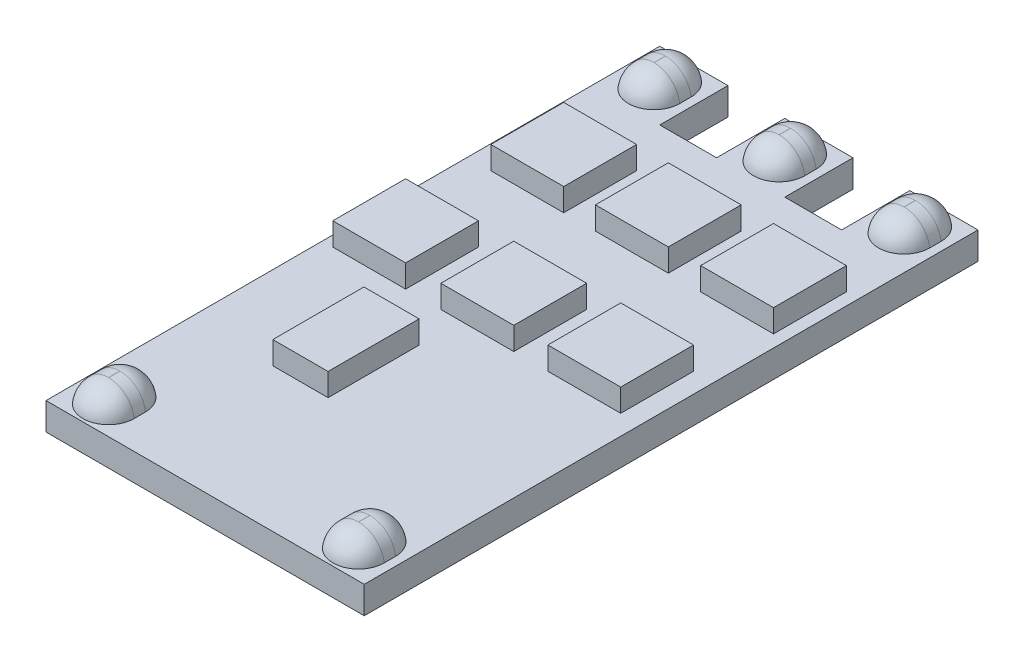
from build123d import *

# Parameters (mm, degrees)
SKETCH1_W               = 14
SKETCH1_H               = 24
SKETCH1_W_2             = 3
SKETCH1_H_2             = 3
PCB_DEPTH               = 1.2
SOLDER_JOINTS_DEPTH     = 1
SOLDER_FILLETS_R        = 1.125
SKETCH2_W               = 3.205722041
SKETCH2_H               = 3.205722042
SKETCH2_W_2             = 3.205722042
SKETCH2_W_3             = 2.430144128
SKETCH2_H_2             = 4.007152552
TOP_COMPONENTS_DEPTH    = 1
SKETCH3_W               = 4.033005149
SKETCH3_H               = 4.058308378
SKETCH3_W_2             = 3.102311653
SKETCH3_H_2             = 2.921343474
SKETCH3_W_3             = 2.817933085
SKETCH3_W_4             = 2.869638279
SKETCH3_W_5             = 1.835534395
SKETCH3_H_3             = 3.12816425
BOTTOM_COMPONENTS_DEPTH = 1


with BuildPart() as part:
    # Sketch1 → PCB (new body)
    with BuildSketch(Plane(origin=(0, 0, 0), x_dir=(1, 0, 0), z_dir=(0, 1, 0))):
        Rectangle(SKETCH1_W, SKETCH1_H)
        with Locations((-5.5, 13.5)):
            Rectangle(SKETCH1_W_2, SKETCH1_H_2)
        with Locations((0, 13.5)):
            Rectangle(SKETCH1_W_2, SKETCH1_H_2)
        with Locations((5.5, 13.5)):
            Rectangle(SKETCH1_W_2, SKETCH1_H_2)
    extrude(amount=PCB_DEPTH)

    # Sketch5 → Solder joints (add)
    with BuildSketch(Plane(origin=(0, 1.2, 0), x_dir=(1, 0, 0), z_dir=(0, 1, 0))):
        with BuildLine():
            Line((-4.375, 13.25), (-4.375, 13.75))
            ThreePointArc((-4.375, 13.75), (-5.5, 14.875), (-6.625, 13.75))
            Line((-6.625, 13.75), (-6.625, 13.25))
            ThreePointArc((-6.625, 13.25), (-5.5, 12.125), (-4.375, 13.25))
        make_face()
        with BuildLine():
            Line((-1.125, 13.75), (-1.125, 13.25))
            ThreePointArc((-1.125, 13.25), (0, 12.125), (1.125, 13.25))
            Line((1.125, 13.25), (1.125, 13.75))
            ThreePointArc((1.125, 13.75), (0, 14.875), (-1.125, 13.75))
        make_face()
        with BuildLine():
            Line((4.375, 13.75), (4.375, 13.25))
            ThreePointArc((4.375, 13.25), (5.5, 12.125), (6.625, 13.25))
            Line((6.625, 13.25), (6.625, 13.75))
            ThreePointArc((6.625, 13.75), (5.5, 14.875), (4.375, 13.75))
        make_face()
        with BuildLine():
            Line((-6.625, -10.25), (-6.625, -10.75))
            ThreePointArc((-6.625, -10.75), (-5.5, -11.875), (-4.375, -10.75))
            Line((-4.375, -10.75), (-4.375, -10.25))
            ThreePointArc((-4.375, -10.25), (-5.5, -9.125), (-6.625, -10.25))
        make_face()
        with BuildLine():
            ThreePointArc((6.625, -10.75), (5.5, -11.875), (4.375, -10.75))
            Line((4.375, -10.75), (4.375, -10.25))
            ThreePointArc((4.375, -10.25), (5.5, -9.125), (6.625, -10.25))
            Line((6.625, -10.25), (6.625, -10.75))
        make_face()
    extrude(amount=SOLDER_JOINTS_DEPTH)

    # Solder fillets
    # the kernel refuses this fillet: 1.125 mm, written as the material it takes off along each edge
    with BuildSketch(Plane(origin=(-5.5, 2.2, 10.25), x_dir=(1, 0, 0), z_dir=(0, 0, 1))) as solder_fillets_piece_1:
        with BuildLine():
            CenterArc((0.006966011, -1.125), SOLDER_FILLETS_R, 6.379370208, 83.620629792)
            Line((0.006966011, 0), (0.006966011, 0.0225))
            Line((0.006966011, 0.0225), (1.125, 0.0225))
            Line((1.125, 0.0225), (1.1475, 0))
            ThreePointArc((1.1475, 0), (1.1475, -0.5), (1.14736068, -0.9975))
            Line((1.14736068, -0.9975), (1.125, -1))
        make_face()
    revolve(axis=Axis((-5.5, 2.2, 10.25), (0, 1, 0)), revolution_arc=180, mode=Mode.SUBTRACT)
    with BuildSketch(Plane(origin=(-4.375, 2.2, 10.75), x_dir=(0, -1, 0), z_dir=(0, 0, -1)), Plane(origin=(-6.625, 2.2, 10.25), x_dir=(0, -1, 0), z_dir=(0, 0, 1)), Plane(origin=(6.625, 2.2, -13.25), x_dir=(0, -1, 0), z_dir=(0, 0, -1)), Plane(origin=(4.375, 2.2, -13.75), x_dir=(0, -1, 0), z_dir=(0, 0, 1)), Plane(origin=(1.125, 2.2, -13.25), x_dir=(0, -1, 0), z_dir=(0, 0, -1)), Plane(origin=(-1.125, 2.2, -13.75), x_dir=(0, -1, 0), z_dir=(0, 0, 1)), Plane(origin=(-6.625, 2.2, -13.75), x_dir=(0, -1, 0), z_dir=(0, 0, 1)), Plane(origin=(-4.375, 2.2, -13.25), x_dir=(0, -1, 0), z_dir=(0, 0, -1))) as solder_fillets_piece_2:
        with BuildLine():
            CenterArc((1.125, 1.118033989), SOLDER_FILLETS_R, 180, 83.620629792)
            Line((0, 1.118033989), (-0.0225, 1.118033989))
            Line((-0.0225, 1.118033989), (-0.0225, 0))
            Line((-0.0225, 0), (0, -0.0225))
            ThreePointArc((0, -0.0225), (0.5, -0.0225), (0.9975, -0.02236068))
            Line((0.9975, -0.02236068), (1, 0))
        make_face()
    extrude(amount=0.5, mode=Mode.SUBTRACT)
    with BuildSketch(Plane(origin=(-5.5, 2.2, 10.75), x_dir=(-1, 0, 0), z_dir=(0, 0, -1))) as solder_fillets_piece_3:
        with BuildLine():
            CenterArc((0.006966011, -1.125), SOLDER_FILLETS_R, 6.379370208, 83.620629792)
            Line((0.006966011, 0), (0.006966011, 0.0225))
            Line((0.006966011, 0.0225), (1.125, 0.0225))
            Line((1.125, 0.0225), (1.1475, 0))
            ThreePointArc((1.1475, 0), (1.1475, -0.5), (1.14736068, -0.9975))
            Line((1.14736068, -0.9975), (1.125, -1))
        make_face()
    revolve(axis=Axis((-5.5, 2.2, 10.75), (0, 1, 0)), revolution_arc=180, mode=Mode.SUBTRACT)
    with BuildSketch(Plane(origin=(4.375, 2.2, 10.75), x_dir=(0, -1, 0), z_dir=(0, 0, -1)), Plane(origin=(6.625, 2.2, 10.25), x_dir=(0, -1, 0), z_dir=(0, 0, 1))) as solder_fillets_piece_4:
        with BuildLine():
            CenterArc((1.125, -1.118033989), SOLDER_FILLETS_R, 96.379370208, 83.620629792)
            Line((0, -1.118033989), (-0.0225, -1.118033989))
            Line((-0.0225, -1.118033989), (-0.0225, 0))
            Line((-0.0225, 0), (0, 0.0225))
            ThreePointArc((0, 0.0225), (0.5, 0.0225), (0.9975, 0.02236068))
            Line((0.9975, 0.02236068), (1, 0))
        make_face()
    extrude(amount=0.5, mode=Mode.SUBTRACT)
    with BuildSketch(Plane(origin=(5.5, 2.2, 10.25), x_dir=(-1, 0, 0), z_dir=(0, 0, 1))) as solder_fillets_piece_5:
        with BuildLine():
            CenterArc((0.006966011, 1.125), SOLDER_FILLETS_R, 270, 83.620629792)
            Line((0.006966011, 0), (0.006966011, -0.0225))
            Line((0.006966011, -0.0225), (1.125, -0.0225))
            Line((1.125, -0.0225), (1.1475, 0))
            ThreePointArc((1.1475, 0), (1.1475, 0.5), (1.14736068, 0.9975))
            Line((1.14736068, 0.9975), (1.125, 1))
        make_face()
    revolve(axis=Axis((5.5, 2.2, 10.25), (0, -1, 0)), revolution_arc=180, mode=Mode.SUBTRACT)
    with BuildSketch(Plane(origin=(5.5, 2.2, 10.75), x_dir=(1, 0, 0), z_dir=(0, 0, -1))) as solder_fillets_piece_6:
        with BuildLine():
            CenterArc((0.006966011, 1.125), SOLDER_FILLETS_R, 270, 83.620629792)
            Line((0.006966011, 0), (0.006966011, -0.0225))
            Line((0.006966011, -0.0225), (1.125, -0.0225))
            Line((1.125, -0.0225), (1.1475, 0))
            ThreePointArc((1.1475, 0), (1.1475, 0.5), (1.14736068, 0.9975))
            Line((1.14736068, 0.9975), (1.125, 1))
        make_face()
    revolve(axis=Axis((5.5, 2.2, 10.75), (0, -1, 0)), revolution_arc=180, mode=Mode.SUBTRACT)
    with BuildSketch(Plane(origin=(5.5, 2.2, -13.75), x_dir=(1, 0, 0), z_dir=(0, 0, 1))) as solder_fillets_piece_7:
        with BuildLine():
            CenterArc((0.006966011, -1.125), SOLDER_FILLETS_R, 6.379370208, 83.620629792)
            Line((0.006966011, 0), (0.006966011, 0.0225))
            Line((0.006966011, 0.0225), (1.125, 0.0225))
            Line((1.125, 0.0225), (1.1475, 0))
            ThreePointArc((1.1475, 0), (1.1475, -0.5), (1.14736068, -0.9975))
            Line((1.14736068, -0.9975), (1.125, -1))
        make_face()
    revolve(axis=Axis((5.5, 2.2, -13.75), (0, 1, 0)), revolution_arc=180, mode=Mode.SUBTRACT)
    with BuildSketch(Plane(origin=(5.5, 2.2, -13.25), x_dir=(-1, 0, 0), z_dir=(0, 0, -1))) as solder_fillets_piece_8:
        with BuildLine():
            CenterArc((0.006966011, -1.125), SOLDER_FILLETS_R, 6.379370208, 83.620629792)
            Line((0.006966011, 0), (0.006966011, 0.0225))
            Line((0.006966011, 0.0225), (1.125, 0.0225))
            Line((1.125, 0.0225), (1.1475, 0))
            ThreePointArc((1.1475, 0), (1.1475, -0.5), (1.14736068, -0.9975))
            Line((1.14736068, -0.9975), (1.125, -1))
        make_face()
    revolve(axis=Axis((5.5, 2.2, -13.25), (0, 1, 0)), revolution_arc=180, mode=Mode.SUBTRACT)
    with BuildSketch(Plane(origin=(0, 2.2, -13.75), x_dir=(1, 0, 0), z_dir=(0, 0, 1))) as solder_fillets_piece_9:
        with BuildLine():
            CenterArc((0.006966011, -1.125), SOLDER_FILLETS_R, 6.379370208, 83.620629792)
            Line((0.006966011, 0), (0.006966011, 0.0225))
            Line((0.006966011, 0.0225), (1.125, 0.0225))
            Line((1.125, 0.0225), (1.1475, 0))
            ThreePointArc((1.1475, 0), (1.1475, -0.5), (1.14736068, -0.9975))
            Line((1.14736068, -0.9975), (1.125, -1))
        make_face()
    revolve(axis=Axis((0, 2.2, -13.75), (0, 1, 0)), revolution_arc=180, mode=Mode.SUBTRACT)
    with BuildSketch(Plane(origin=(0, 2.2, -13.25), x_dir=(-1, 0, 0), z_dir=(0, 0, -1))) as solder_fillets_piece_10:
        with BuildLine():
            CenterArc((0.006966011, -1.125), SOLDER_FILLETS_R, 6.379370208, 83.620629792)
            Line((0.006966011, 0), (0.006966011, 0.0225))
            Line((0.006966011, 0.0225), (1.125, 0.0225))
            Line((1.125, 0.0225), (1.1475, 0))
            ThreePointArc((1.1475, 0), (1.1475, -0.5), (1.14736068, -0.9975))
            Line((1.14736068, -0.9975), (1.125, -1))
        make_face()
    revolve(axis=Axis((0, 2.2, -13.25), (0, 1, 0)), revolution_arc=180, mode=Mode.SUBTRACT)
    with BuildSketch(Plane(origin=(-5.5, 2.2, -13.25), x_dir=(-1, 0, 0), z_dir=(0, 0, -1))) as solder_fillets_piece_11:
        with BuildLine():
            CenterArc((0.006966011, -1.125), SOLDER_FILLETS_R, 6.379370208, 83.620629792)
            Line((0.006966011, 0), (0.006966011, 0.0225))
            Line((0.006966011, 0.0225), (1.125, 0.0225))
            Line((1.125, 0.0225), (1.1475, 0))
            ThreePointArc((1.1475, 0), (1.1475, -0.5), (1.14736068, -0.9975))
            Line((1.14736068, -0.9975), (1.125, -1))
        make_face()
    revolve(axis=Axis((-5.5, 2.2, -13.25), (0, 1, 0)), revolution_arc=180, mode=Mode.SUBTRACT)
    with BuildSketch(Plane(origin=(-5.5, 2.2, -13.75), x_dir=(1, 0, 0), z_dir=(0, 0, 1))) as solder_fillets_piece_12:
        with BuildLine():
            CenterArc((0.006966011, -1.125), SOLDER_FILLETS_R, 6.379370208, 83.620629792)
            Line((0.006966011, 0), (0.006966011, 0.0225))
            Line((0.006966011, 0.0225), (1.125, 0.0225))
            Line((1.125, 0.0225), (1.1475, 0))
            ThreePointArc((1.1475, 0), (1.1475, -0.5), (1.14736068, -0.9975))
            Line((1.14736068, -0.9975), (1.125, -1))
        make_face()
    revolve(axis=Axis((-5.5, 2.2, -13.75), (0, 1, 0)), revolution_arc=180, mode=Mode.SUBTRACT)

    # Sketch2 → Top components (add)
    with BuildSketch(Plane(origin=(0, 1.2, 0), x_dir=(1, 0, 0), z_dir=(0, 1, 0))):
        with Locations((-4.369088912, 8.144117457)):
            Rectangle(SKETCH2_W, SKETCH2_H)
        with Locations((0.232673374, 8.144117457)):
            Rectangle(SKETCH2_W_2, SKETCH2_H)
        with Locations((4.860288257, 8.144117457)):
            Rectangle(SKETCH2_W, SKETCH2_H)
        with Locations((-4.937846048, 1.758525971)):
            Rectangle(SKETCH2_W_2, SKETCH2_H)
        with Locations((-0.18096818, 1.758525971)):
            Rectangle(SKETCH2_W_2, SKETCH2_H)
        with Locations((4.524204494, 1.758525971)):
            Rectangle(SKETCH2_W_2, SKETCH2_H)
        with Locations((-2.119912963, -3.68344572)):
            Rectangle(SKETCH2_W_3, SKETCH2_H_2)
    extrude(amount=TOP_COMPONENTS_DEPTH)

    # Sketch3 → Bottom components (add)
    with BuildSketch(Plane.XZ):
        with Locations((-0.775577914, 2.029154189)):
            Rectangle(SKETCH3_W, SKETCH3_H)
        with Locations((-4.343236315, -5.442521059)):
            Rectangle(SKETCH3_W_2, SKETCH3_H_2)
        with Locations((0.090484089, -5.442521059)):
            Rectangle(SKETCH3_W_3, SKETCH3_H_2)
        with Locations((4.511278196, -5.442521059)):
            Rectangle(SKETCH3_W_4, SKETCH3_H_2)
        with Locations((4.433720405, 7.923271646)):
            Rectangle(SKETCH3_W_5, SKETCH3_H_3)
    extrude(amount=BOTTOM_COMPONENTS_DEPTH)


solid = part.part
